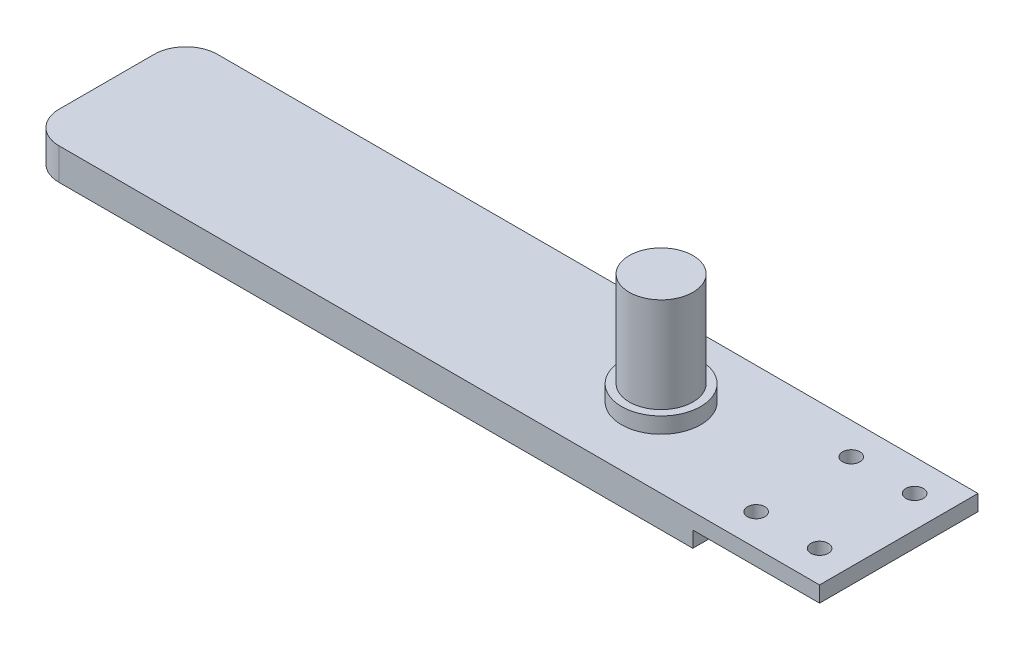
from build123d import *

# Parameters (mm, degrees)
SKETCH1_W           = 100
SKETCH1_H           = 50
BOSS_EXTRUDE1_DEPTH = 10
SKETCH8_W           = 150
SKETCH8_H           = 50
BOSS_EXTRUDE3_DEPTH = 10
SKETCH10_R          = 12.5
BOSS_EXTRUDE4_DEPTH = 5
SKETCH12_R          = 10.05
BOSS_EXTRUDE5_DEPTH = 30
SKETCH13_W          = 40
SKETCH13_H          = 50
CUT_EXTRUDE3_DEPTH  = 5
FILLET1_R           = 10


# Read off the part's stored shape, not the designer's step: M5 Clearance Hole1
with BuildPart() as part:
    # Sketch1 → Boss-Extrude1 (new body)
    with BuildSketch(Plane(origin=(0, 0, 0), x_dir=(1, 0, 0), z_dir=(0, 1, 0))):
        Rectangle(SKETCH1_W, SKETCH1_H)
    extrude(amount=BOSS_EXTRUDE1_DEPTH)

    # Sketch8 → Boss-Extrude3 (add)
    with BuildSketch(Plane(origin=(0, 10, 0), x_dir=(1, 0, 0), z_dir=(0, 1, 0))):
        with Locations((-125, 0)):
            Rectangle(SKETCH8_W, SKETCH8_H)
    extrude(amount=-BOSS_EXTRUDE3_DEPTH)

    # Sketch10 → Boss-Extrude4 (add)
    with BuildSketch(Plane(origin=(0, 10, 0), x_dir=(1, 0, 0), z_dir=(0, 1, 0))):
        with Locations(Location((-25, 0, 0), (0, 0, 270))):
            Circle(SKETCH10_R)
    extrude(amount=BOSS_EXTRUDE4_DEPTH)

    # Sketch12 → Boss-Extrude5 (add)
    with BuildSketch(Plane(origin=(0, 15, 0), x_dir=(1, 0, 0), z_dir=(0, 1, 0))):
        with Locations(Location((-25, 0, 0), (0, 0, 270))):
            Circle(SKETCH12_R)
    extrude(amount=BOSS_EXTRUDE5_DEPTH)

    # Sketch13 → Cut-Extrude3 (cut)
    with BuildSketch(Plane.XZ):
        with Locations((30, 0)):
            Rectangle(SKETCH13_W, SKETCH13_H)
    extrude(amount=-CUT_EXTRUDE3_DEPTH, mode=Mode.SUBTRACT)

    # M5 Clearance Hole1 outline → M5 Clearance Hole1 (revolve, cut)
    with BuildSketch(Plane(origin=(20, 0, -15), x_dir=(1, 0, 0), z_dir=(0, 0, 1))):
        Polygon((2.75, 5.025), (2.75, 10), (0, 10), (0, 5), (2.775, 5), align=None)
    revolve(axis=Axis((20, 0, -15), (0, 1, 0)), mode=Mode.SUBTRACT)

    # M5 Clearance Hole1 2 outline → M5 Clearance Hole1 2 (revolve, cut)
    with BuildSketch(Plane(origin=(20, 0, 15), x_dir=(1, 0, 0), z_dir=(0, 0, 1))):
        Polygon((2.75, 5.025), (2.75, 10), (0, 10), (0, 5), (2.775, 5), align=None)
    revolve(axis=Axis((20, 0, 15), (0, 1, 0)), mode=Mode.SUBTRACT)

    # M5 Clearance Hole1 3 outline → M5 Clearance Hole1 3 (revolve, cut)
    with BuildSketch(Plane(origin=(40, 0, 15), x_dir=(1, 0, 0), z_dir=(0, 0, 1))):
        Polygon((2.75, 5.025), (2.75, 10), (0, 10), (0, 5), (2.775, 5), align=None)
    revolve(axis=Axis((40, 0, 15), (0, 1, 0)), mode=Mode.SUBTRACT)

    # M5 Clearance Hole1 4 outline → M5 Clearance Hole1 4 (revolve, cut)
    with BuildSketch(Plane(origin=(40, 0, -15), x_dir=(1, 0, 0), z_dir=(0, 0, 1))):
        Polygon((2.75, 5.025), (2.75, 10), (0, 10), (0, 5), (2.775, 5), align=None)
    revolve(axis=Axis((40, 0, -15), (0, 1, 0)), mode=Mode.SUBTRACT)

    # Fillet1
    fillet1_edges = [part.edges().sort_by_distance(p)[0] for p in [
        (-200, 5, -25),
        (-200, 5, 25),
    ]]
    fillet(fillet1_edges, radius=FILLET1_R)


solid = part.part
